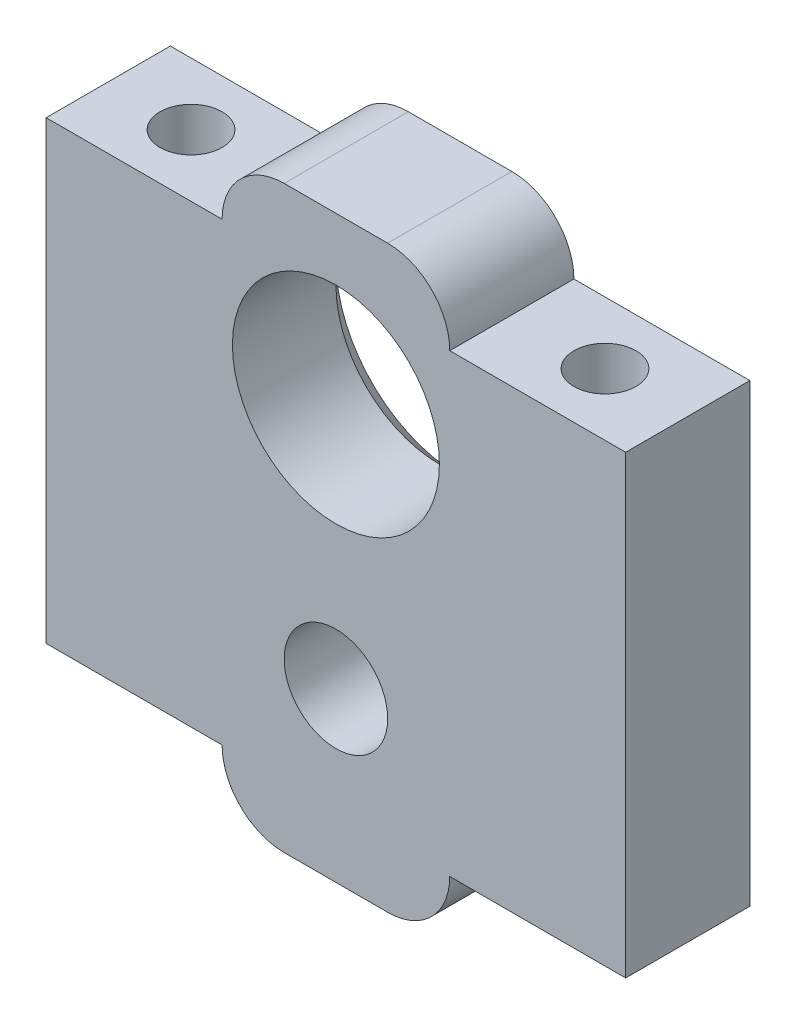
from build123d import *

# Parameters (mm, degrees)
SKETCH_1_W          = 28
SKETCH_1_H          = 28
SKETCH_1_R          = 2.5
SKETCH_1_R_2        = 5
EXTRUDE_1_DEPTH     = 6
SKETCH_2_R          = 1.5
CUT_EXTRUDE_1_DEPTH = 32.874754901
CHAMFER_2_SIZE      = 1
SKETCH_8_W          = 28
SKETCH_8_H          = 0.1
EXTRUDE_4_DEPTH     = 6
SKETCH_9_W          = 28
SKETCH_9_H          = 0.1
CUT_EXTRUDE_4_DEPTH = 21.755962999
SKETCH_10_R         = 1.5
CUT_EXTRUDE_5_DEPTH = 32.874754901
CUT_EXTRUDE_START   = -3
SKETCH_11_W         = 9
SKETCH_11_H         = 10
SKETCH_11_R         = 1.5
CUT_EXTRUDE_6_DEPTH = 3
SKETCH_12_W         = 9
SKETCH_12_H         = 9
SKETCH_12_R         = 1.5
CUT_EXTRUDE_7_DEPTH = 3
FILLET_1_R          = 3


with BuildPart() as part:
    # 草图1 → 凸台-拉伸1 (new body)
    with BuildSketch(Plane.XY):
        Rectangle(SKETCH_1_W, SKETCH_1_H)
        with Locations((0, -6)):
            Circle(SKETCH_1_R, mode=Mode.SUBTRACT)
        with Locations((0, 5.9)):
            Circle(SKETCH_1_R_2, mode=Mode.SUBTRACT)
    extrude(amount=EXTRUDE_1_DEPTH)

    # 草图2 → 切除-拉伸1 (cut, through all)
    with BuildSketch(Plane(origin=(0, -14, 0), x_dir=(-1, 0, 0), z_dir=(0, -1, 0))):
        with Locations(Location((10, -3, 0), (0, 0, 180))):
            Circle(SKETCH_2_R)
        with Locations(Location((-10, -3, 0), (0, 0, 180))):
            Circle(SKETCH_2_R)
    extrude(amount=-CUT_EXTRUDE_1_DEPTH, mode=Mode.SUBTRACT)

    # 倒角2
    chamfer_2_edges = [part.edges().sort_by_distance(p)[0] for p in [
        (-5, 5.9, 0),
    ]]
    chamfer(chamfer_2_edges, length=CHAMFER_2_SIZE)

    # 草图8 → 凸台-拉伸4 (add)
    with BuildSketch(Plane(origin=(0, 0, 0), x_dir=(-1, 0, 0), z_dir=(0, 0, -1))):
        with Locations((0, -14.05)):
            Rectangle(SKETCH_8_W, SKETCH_8_H)
    extrude(amount=-EXTRUDE_4_DEPTH)

    # 草图9 → 切除-拉伸4 (cut, through all)
    with BuildSketch(Plane.XY.offset(6)):
        with Locations((0, 13.95)):
            Rectangle(SKETCH_9_W, SKETCH_9_H)
    extrude(amount=-CUT_EXTRUDE_4_DEPTH, mode=Mode.SUBTRACT)

    # 草图10 → 切除-拉伸5 (cut, through all)
    with BuildSketch(Plane(origin=(0, 13.9, 0), x_dir=(1, 0, 0), z_dir=(0, 1, 0))):
        with Locations(Location((-10, -3, 0), (0, 0, 90))):
            Circle(SKETCH_10_R)
        with Locations(Location((10, -3, 0), (0, 0, 90))):
            Circle(SKETCH_10_R)
    extrude(amount=-CUT_EXTRUDE_5_DEPTH, mode=Mode.SUBTRACT)

    # 草图11 → 切除-拉伸6 (cut)
    # profile 1 of 2: a face of its own
    with BuildSketch(Plane(origin=(0, 13.9, 0), x_dir=(1, 0, 0), z_dir=(0, 1, 0)).offset(CUT_EXTRUDE_START)):
        with Locations((-10, -3)):
            Rectangle(SKETCH_11_W, SKETCH_11_H)
        with Locations(Location((-10, -3, 0), (0, 0, 270))):
            Circle(SKETCH_11_R, mode=Mode.SUBTRACT)
    # profile 2 of 2: a face of its own
    with BuildSketch(Plane(origin=(0, 13.9, 0), x_dir=(1, 0, 0), z_dir=(0, 1, 0)).offset(CUT_EXTRUDE_START)):
        with Locations((10, -3)):
            Rectangle(SKETCH_11_W, SKETCH_11_H)
    extrude(amount=CUT_EXTRUDE_6_DEPTH, mode=Mode.SUBTRACT)

    # 草图12 → 切除-拉伸7 (cut)
    # profile 1 of 2: a face of its own
    with BuildSketch(Plane.XZ.offset(14.1)):
        with Locations((-10, 3)):
            Rectangle(SKETCH_12_W, SKETCH_12_H)
        with Locations(Location((-10, 3, 0), (0, 0, 270))):
            Circle(SKETCH_12_R, mode=Mode.SUBTRACT)
    # profile 2 of 2: a face of its own
    with BuildSketch(Plane.XZ.offset(14.1)):
        with Locations((10, 3)):
            Rectangle(SKETCH_12_W, SKETCH_12_H)
    extrude(amount=-CUT_EXTRUDE_7_DEPTH, mode=Mode.SUBTRACT)

    # 圆角1
    fillet_1_edges = [part.edges().sort_by_distance(p)[0] for p in [
        (5.5, -14.1, 3),
        (-5.5, -14.1, 3),
        (5.5, 13.9, 3),
        (-5.5, 13.9, 3),
    ]]
    fillet(fillet_1_edges, radius=FILLET_1_R - 0.0001)  # a hair under: the kernel refuses the full size


solid = part.part
